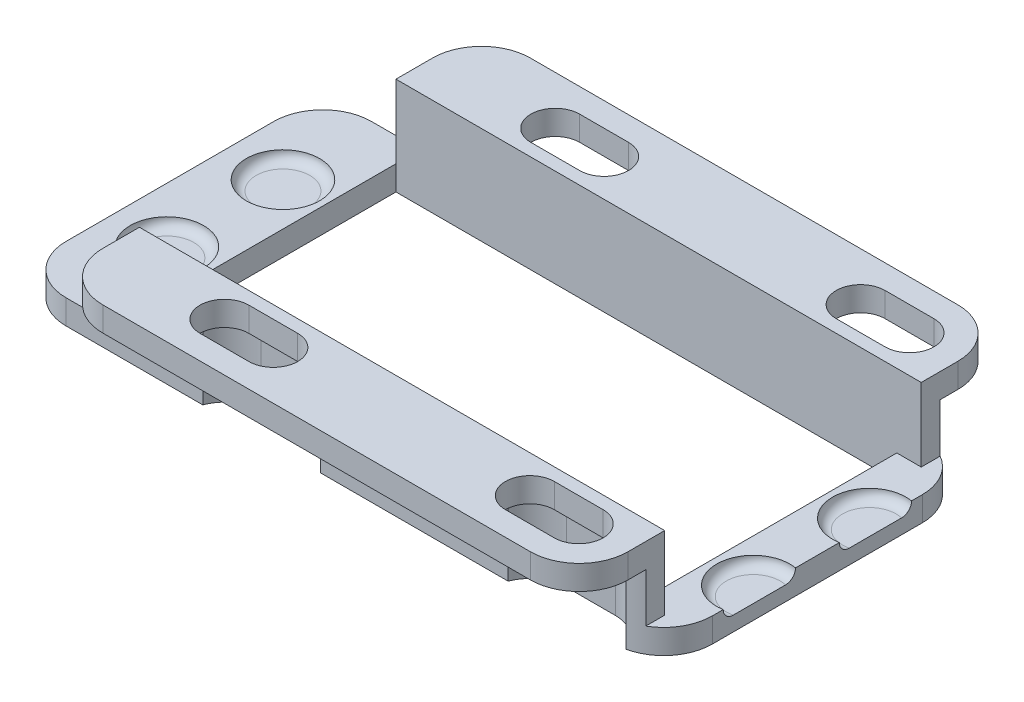
from build123d import *

# Parameters (mm, degrees)
EXTRUDE_2_DEPTH     = 2
CUT_EXTRUDE_2_DEPTH = 0.8
FILLET_1_R          = 0.8
SKETCH_6_W          = 43
SKETCH_6_H          = 2
SKETCH_6_H_2        = 1.9999999999999947
EXTRUDE_3_DEPTH     = 4
SKETCH_7_W          = 43
SKETCH_7_H          = 6.999999999999998
EXTRUDE_4_DEPTH     = 2
CUT_EXTRUDE_3_DEPTH = 35.3874977280988
CUT_EXTRUDE_5_DEPTH = 6
FILLET_2_R          = 4
FILLET_3_R          = 4
FILLET_4_R          = 4


# Some blends are built 0.0001 mm under size
with BuildPart() as part:
    # 草图4 → 凸台-拉伸2 (new body)
    with BuildSketch(Plane(origin=(0, 0, 0), x_dir=(1, 0, 0), z_dir=(0, 1, 0))):
        Polygon((24.499999999999996, -12.499999999999993), (24.499999999999996, 10.5), (24.499999999999996, 12.5), (-24.500000000000004, 12.5), (-28.500000000000004, 12.5), (-28.500000000000004, -12.499999999999993), (-24.500000000000004, -12.499999999999993), align=None)
        Polygon((-20.500000000000004, 10.500000000000002), (20.499999999999996, 10.5), (20.500000000000004, -10.5), (-20.5, -10.499999999999998), align=None, mode=Mode.SUBTRACT)
    extrude(amount=EXTRUDE_2_DEPTH)

    # 草图5 → 切除-拉伸2 (cut)
    with BuildSketch(Plane(origin=(0, 2, 0), x_dir=(1, 0, 0), z_dir=(0, 1, 0))):
        with BuildLine():
            Line((-24.000000000000004, 1.7499999999999991), (-24.000000000000004, 4.75))
            Line((-24.000000000000004, 4.75), (-21.000000000000004, 4.75))
            ThreePointArc((-21.000000000000004, 4.75), (-26.121320343559606, 6.871320343559683), (-24.000000000000117, 1.7499999999999991))
        make_face()
        with BuildLine():
            Line((-21.000000000000004, 4.75), (-24.000000000000004, 4.75))
            Line((-24.000000000000004, 4.75), (-24.000000000000004, 1.7499999999999991))
            ThreePointArc((-24.000000000000117, 1.7499999999999991), (-21.8786796564404, 2.6286796564403168), (-21.000000000000004, 4.749999999999999))
        make_face()
        with BuildLine():
            ThreePointArc((-21.000000000000007, -4.75), (-21.8786796564404, -2.6286796564403203), (-24.000000000000114, -1.7500000000000027))
            Line((-24.000000000000004, -1.7500000000000027), (-24.000000000000004, -4.75))
            Line((-24.000000000000004, -4.75), (-21.000000000000007, -4.75))
        make_face()
        with BuildLine():
            Line((-24.000000000000004, -4.75), (-24.000000000000004, -1.7500000000000027))
            ThreePointArc((-24.000000000000114, -1.7500000000000027), (-26.121320343559606, -6.871320343559679), (-21.000000000000007, -4.750000000000001))
            Line((-21.000000000000007, -4.75), (-24.000000000000004, -4.75))
        make_face()
        with BuildLine():
            Line((23.999999999999996, 4.75), (20.999999999999996, 4.75))
            ThreePointArc((21, 4.75), (21.878679656440315, 2.628679656440399), (23.999999999999883, 1.7500000000000027))
            Line((23.999999999999996, 1.7500000000000027), (23.999999999999996, 4.75))
        make_face()
        with BuildLine():
            ThreePointArc((24.50000000000003, 7.7080398915498), (22.063508326896304, 7.041287847477928), (21, 4.75))
            Line((20.999999999999996, 4.75), (23.999999999999996, 4.75))
            Line((23.999999999999996, 4.75), (23.999999999999996, 1.7500000000000027))
            ThreePointArc((23.999999999999883, 1.7500000000000027), (24.250878780839006, 1.760508431635119), (24.500000000000025, 1.7919601084501995))
            Line((24.499999999999996, 1.7919601084502048), (24.499999999999996, 7.708039891549795))
        make_face()
        with BuildLine():
            ThreePointArc((24.500000000000025, -1.7919601084501955), (24.25087878083901, -1.7605084316351154), (23.99999999999989, -1.7499999999999991))
            Line((24, -1.7499999999999991), (24, -4.75))
            Line((23.999999999999996, -4.75), (20.999999999999996, -4.75))
            ThreePointArc((21, -4.75), (22.0635083268963, -7.041287847477928), (24.50000000000002, -7.708039891549806))
            Line((24.499999999999996, -7.7080398915498005), (24.499999999999996, -1.7919601084501995))
        make_face()
        with BuildLine():
            Line((24, -4.75), (24, -1.7499999999999991))
            ThreePointArc((23.99999999999989, -1.7499999999999991), (21.87867965644032, -2.6286796564403963), (21, -4.75))
            Line((20.999999999999996, -4.75), (23.999999999999996, -4.75))
        make_face()
    extrude(amount=-CUT_EXTRUDE_2_DEPTH, mode=Mode.SUBTRACT)

    # 圆角1
    fillet_1_edges = [part.edges().sort_by_distance(p)[0] for p in [
        (21.000000000000117, 1.2, 4.749999999999868),
        (21, 1.2, -4.75),
        (-26.999999999999993, 1.2, 4.749999999999993),
        (-23.99999999999989, 1.2, -7.749999999999999),
    ]]
    fillet(fillet_1_edges, radius=FILLET_1_R - 0.0001)  # a hair under: the kernel refuses the full size

    # 草图6 → 凸台-拉伸3 (add)
    with BuildSketch(Plane(origin=(0, 2, 0), x_dir=(1, 0, 0), z_dir=(0, 1, 0))):
        with Locations((0.9999999999999947, 11.500000000000002)):
            Rectangle(SKETCH_6_W, SKETCH_6_H)
        with Locations((0.9999999999999982, -11.499999999999996)):
            Rectangle(SKETCH_6_W, SKETCH_6_H_2)
    extrude(amount=EXTRUDE_3_DEPTH)

    # 草图7 → 凸台-拉伸4 (add)
    with BuildSketch(Plane(origin=(0, 6, 0), x_dir=(1, 0, 0), z_dir=(0, 1, 0))):
        with Locations((0.9999999999999947, 14)):
            Rectangle(SKETCH_7_W, SKETCH_7_H)
        with Locations((0.9999999999999982, -13.999999999999996)):
            Rectangle(SKETCH_7_W, SKETCH_7_H)
    extrude(amount=EXTRUDE_4_DEPTH)

    # 草图8 → 切除-拉伸3 (cut, through all)
    with BuildSketch(Plane.XZ):
        with BuildLine():
            ThreePointArc((-10.5, -11.54), (-12.5, -13.54), (-10.5, -15.54))
            Line((-10.5, -15.54), (-6.500000000000001, -15.54))
            ThreePointArc((-6.500000000000001, -15.54), (-4.500000000000001, -13.54), (-6.500000000000001, -11.54))
            Line((-6.500000000000001, -11.54), (-10.5, -11.54))
        make_face()
        with BuildLine():
            ThreePointArc((14.5, -11.54), (12.5, -13.54), (14.5, -15.54))
            Line((14.5, -15.54), (18.500000000000004, -15.54))
            ThreePointArc((18.500000000000004, -15.54), (20.500000000000004, -13.54), (18.500000000000004, -11.54))
            Line((18.500000000000004, -11.54), (14.5, -11.54))
        make_face()
        with BuildLine():
            Line((-10.500000000000096, 11.54), (-6.500000000000095, 11.54))
            ThreePointArc((-6.500000000000095, 11.54), (-4.500000000000095, 13.54), (-6.500000000000095, 15.54))
            Line((-6.500000000000095, 15.54), (-10.500000000000096, 15.54))
            ThreePointArc((-10.500000000000096, 15.54), (-12.500000000000096, 13.54), (-10.500000000000096, 11.54))
        make_face()
        with BuildLine():
            Line((14.499999999999908, 11.54), (18.499999999999904, 11.54))
            ThreePointArc((18.499999999999904, 11.540000000000001), (20.499999999999904, 13.540000000000001), (18.499999999999904, 15.540000000000001))
            Line((18.499999999999904, 15.54), (14.499999999999908, 15.54))
            ThreePointArc((14.499999999999908, 15.54), (12.499999999999908, 13.54), (14.499999999999908, 11.54))
        make_face()
    extrude(amount=-CUT_EXTRUDE_3_DEPTH, mode=Mode.SUBTRACT)

    # 草图9 → 切除-拉伸5 (cut)
    with BuildSketch(Plane.XZ):
        with BuildLine():
            Line((14.5, -10.540000000000001), (18.500000000000004, -10.54))
            ThreePointArc((18.500000000000004, -10.54), (21.500000000000004, -13.54), (18.500000000000004, -16.54))
            Line((18.500000000000004, -16.54), (14.5, -16.54))
            ThreePointArc((14.5, -16.54), (11.500000000000002, -13.54), (14.5, -10.540000000000001))
        make_face()
        with BuildLine():
            Line((-10.5, -10.540000000000177), (-6.499999999999999, -10.540000000000175))
            ThreePointArc((-6.499999999999999, -10.540000000000175), (-3.500000000000001, -13.540000000000175), (-6.499999999999999, -16.540000000000173))
            Line((-6.499999999999999, -16.540000000000173), (-10.5, -16.540000000000173))
            ThreePointArc((-10.5, -16.540000000000173), (-13.499999999999998, -13.540000000000175), (-10.5, -10.540000000000177))
        make_face()
        with BuildLine():
            Line((-10.500000000000094, 16.539999999999825), (-6.500000000000092, 16.539999999999825))
            ThreePointArc((-6.500000000000092, 16.539999999999825), (-3.5000000000000924, 13.539999999999827), (-6.500000000000092, 10.539999999999827))
            Line((-6.500000000000092, 10.539999999999827), (-10.500000000000094, 10.539999999999827))
            ThreePointArc((-10.500000000000094, 10.539999999999827), (-13.500000000000092, 13.539999999999827), (-10.500000000000094, 16.539999999999825))
        make_face()
        with BuildLine():
            Line((14.499999999999906, 16.54), (18.499999999999908, 16.54))
            ThreePointArc((18.499999999999908, 16.54), (21.499999999999908, 13.54), (18.499999999999908, 10.540000000000001))
            Line((18.499999999999908, 10.540000000000001), (14.499999999999906, 10.540000000000001))
            ThreePointArc((14.499999999999906, 10.540000000000001), (11.499999999999906, 13.54), (14.499999999999906, 16.54))
        make_face()
    extrude(amount=-CUT_EXTRUDE_5_DEPTH, mode=Mode.SUBTRACT)

    # 圆角2
    # the kernel refuses this fillet: 4 mm, written as the material it takes off along each edge
    with BuildSketch(Plane(origin=(24.499999999999996, -9.790767556640994, 12.499999999999993), x_dir=(0, 0, -1), z_dir=(0, 1, 0))) as fillet_2_piece_1_section:
        with BuildLine():
            CenterArc((3.9163070226563974, 4), FILLET_2_R, 191.74119504503736, 78.25880495496267)
            Line((6.39666e-12, 3.186034826087571), (0, 0))
            Line((0, 0), (3.9163070226563974, 0))
        make_face()
    fillet_2_piece_1 = extrude(amount=21.581535113281987, mode=Mode.PRIVATE)
    fillet_2_piece_1 = split(fillet_2_piece_1, bisect_by=Plane(origin=(23.971029818368024, 6, 10.5876929773436), z_dir=(0, -1, 0)), keep=Keep.TOP, mode=Mode.PRIVATE)
    add(fillet_2_piece_1, mode=Mode.SUBTRACT)
    with BuildSketch(Plane(origin=(24.499999999999996, -9.790767556640994, -12.5), x_dir=(0, 0, 1), z_dir=(0, 1, 0))) as fillet_2_piece_2_section:
        with BuildLine():
            CenterArc((3.9163070226563974, -4), FILLET_2_R, 90, 78.25880495496122)
            Line((6.4162e-12, -3.186034826087475), (0, 0))
            Line((0, 0), (3.9163070226563974, 0))
        make_face()
    fillet_2_piece_2 = extrude(amount=21.581535113281987, mode=Mode.PRIVATE)
    fillet_2_piece_2 = split(fillet_2_piece_2, bisect_by=Plane(origin=(23.97102981836802, 6, -10.58769297734361), z_dir=(0, -1, 0)), keep=Keep.TOP, mode=Mode.PRIVATE)
    add(fillet_2_piece_2, mode=Mode.SUBTRACT)
    with BuildSketch(Plane(origin=(22.499999999999993, -4, -17.5), x_dir=(-1, 0, 0), z_dir=(0, 1, 0))) as fillet_2_piece_3:
        with BuildLine():
            CenterArc((FILLET_2_R, FILLET_2_R), FILLET_2_R, 180, 90)
            Line((0, FILLET_2_R), (0, 0))
            Line((0, 0), (FILLET_2_R, 0))
        make_face()
    extrude(amount=22, mode=Mode.SUBTRACT)
    with BuildSketch(Plane(origin=(22.499999999999996, -4, 17.499999999999996), x_dir=(-1, 0, 0), z_dir=(0, 1, 0))) as fillet_2_piece_4:
        with BuildLine():
            CenterArc((FILLET_2_R, -FILLET_2_R), FILLET_2_R, 90, 90)
            Line((0, -FILLET_2_R), (0, 0))
            Line((0, 0), (FILLET_2_R, 0))
        make_face()
    extrude(amount=22, mode=Mode.SUBTRACT)

    # 圆角3
    fillet_3_edges = [part.edges().sort_by_distance(p)[0] for p in [
        (-28.500000000000004, 1, 12.499999999999993),
        (-28.500000000000004, 1, -12.5),
    ]]
    fillet(fillet_3_edges, radius=FILLET_3_R)

    # 圆角4
    fillet_4_edges = [part.edges().sort_by_distance(p)[0] for p in [
        (-20.5, 7, 17.499999999999996),
        (-20.500000000000004, 7, -17.5),
    ]]
    fillet(fillet_4_edges, radius=FILLET_4_R)


solid = part.part
